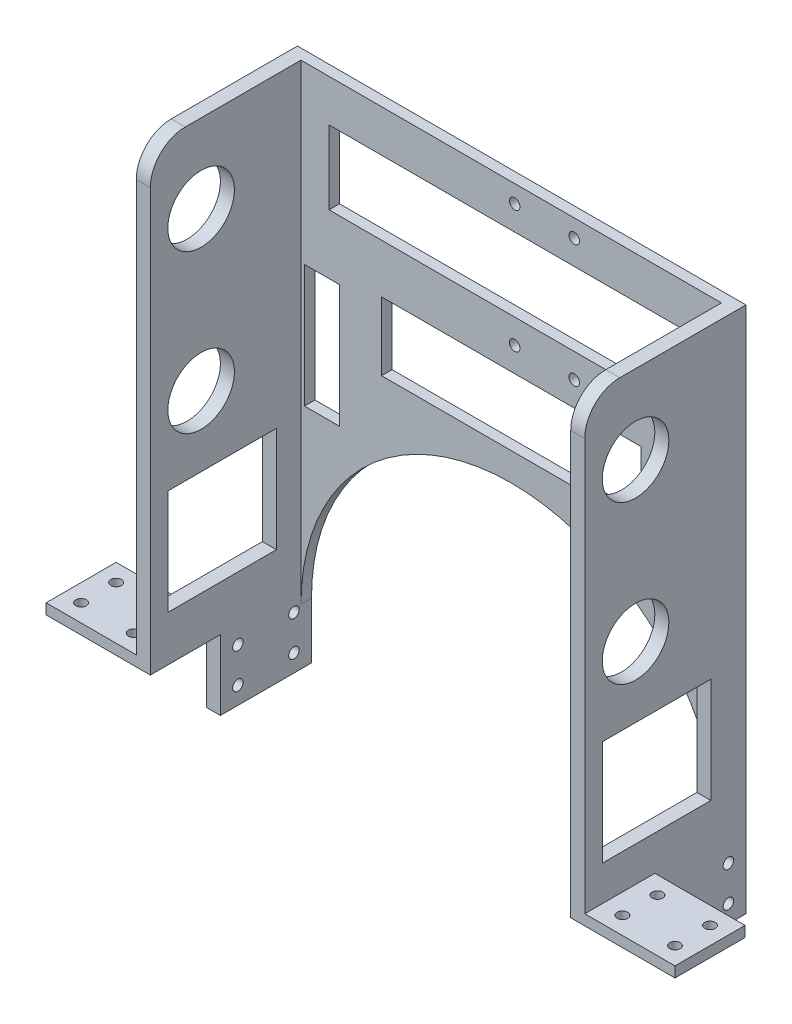
from build123d import *

# Parameters (mm, degrees)
SKETCH_1_W           = 160
SKETCH_1_H           = 157.5
EXTRUDE_1_DEPTH      = 46
SKETCH_2_W           = 120
SKETCH_2_H           = 157.5
CUT_EXTRUDE_1_DEPTH  = 43
SKETCH_3_W           = 16
SKETCH_3_H           = 155
CUT_EXTRUDE_2_DEPTH  = 122.31596144
SKETCH_4_R           = 9.5
CUT_EXTRUDE_3_DEPTH  = 171.451056025
SKETCH_5_R           = 9.5
CUT_EXTRUDE_4_DEPTH  = 171.451056025
SKETCH_7_R           = 1.5
CUT_EXTRUDE_6_DEPTH  = 10
SKETCH_10_W          = 16
SKETCH_10_H          = 26
CUT_EXTRUDE_9_DEPTH  = 10
SKETCH_11_W          = 4
SKETCH_11_H          = 26
EXTRUDE_2_DEPTH      = 20
SKETCH_13_R          = 1.5
CUT_EXTRUDE_11_DEPTH = 181.564566014
SKETCH_17_W          = 29.75
SKETCH_17_H          = 3
EXTRUDE_3_DEPTH      = 20
SKETCH_18_R          = 1.5
CUT_EXTRUDE_14_DEPTH = 20
SKETCH_19_W          = 46
SKETCH_19_H          = 27
CUT_EXTRUDE_15_DEPTH = 189.432016919
SKETCH_20_R          = 30
CUT_EXTRUDE_16_DEPTH = 10
SKETCH_21_W          = 120
SKETCH_21_H          = 56.000000256
CUT_EXTRUDE_17_DEPTH = 10
FILLET_1_R           = 60
SKETCH_22_W          = 10
SKETCH_22_H          = 35
CUT_EXTRUDE_18_DEPTH = 10
FILLET_2_R           = 10
SKETCH_24_W          = 31
SKETCH_24_H          = 30
CUT_EXTRUDE_19_DEPTH = 189.432016919
SKETCH_25_W          = 104
SKETCH_25_H          = 21
SKETCH_25_W_2        = 74
SKETCH_25_H_2        = 19.499999744
CUT_EXTRUDE_20_DEPTH = 10


with BuildPart() as part:
    # 草图1 → 凸台-拉伸1 (new body)
    with BuildSketch(Plane.XY):
        Rectangle(SKETCH_1_W, SKETCH_1_H)
    extrude(amount=EXTRUDE_1_DEPTH)

    # 草图2 → 切除-拉伸1 (cut)
    with BuildSketch(Plane.XY.offset(46)):
        Rectangle(SKETCH_2_W, SKETCH_2_H)
    extrude(amount=-CUT_EXTRUDE_1_DEPTH, mode=Mode.SUBTRACT)

    # 草图3 → 切除-拉伸2 (cut, through all)
    with BuildSketch(Plane.XY.offset(46)):
        with Locations((-72, 1.25)):
            Rectangle(SKETCH_3_W, SKETCH_3_H)
        with Locations((72, 1.25)):
            Rectangle(SKETCH_3_W, SKETCH_3_H)
    extrude(amount=-CUT_EXTRUDE_2_DEPTH, mode=Mode.SUBTRACT)

    # 草图4 → 切除-拉伸3 (cut, through all)
    with BuildSketch(Plane.ZY.offset(64)):
        with Locations((31.5, -15.75)):
            Circle(SKETCH_4_R)
    extrude(amount=-CUT_EXTRUDE_3_DEPTH, mode=Mode.SUBTRACT)

    # 草图5 → 切除-拉伸4 (cut, through all)
    with BuildSketch(Plane(origin=(64, 0, 0), x_dir=(0, 0, -1), z_dir=(1, 0, 0))):
        with Locations(Location((-31.5, 29.25, 0), (0, 0, 90))):
            Circle(SKETCH_5_R)
    extrude(amount=-CUT_EXTRUDE_4_DEPTH, mode=Mode.SUBTRACT)

    # 草图7 → 切除-拉伸6 (cut)
    with BuildSketch(Plane.XY.offset(3)):
        with Locations((1, 46.75)):
            Circle(SKETCH_7_R)
        with Locations((18, 46.75)):
            Circle(SKETCH_7_R)
        with Locations((1, 11.75)):
            Circle(SKETCH_7_R)
        with Locations((18, 11.75)):
            Circle(SKETCH_7_R)
    extrude(amount=-CUT_EXTRUDE_6_DEPTH, mode=Mode.SUBTRACT)

    # 草图10 → 切除-拉伸9 (cut)
    with BuildSketch(Plane(origin=(0, -76.25, 0), x_dir=(1, 0, 0), z_dir=(0, 1, 0))):
        with Locations((-72, -13)):
            Rectangle(SKETCH_10_W, SKETCH_10_H)
        with Locations((72, -13)):
            Rectangle(SKETCH_10_W, SKETCH_10_H)
    extrude(amount=-CUT_EXTRUDE_9_DEPTH, mode=Mode.SUBTRACT)

    # 草图11 → 凸台-拉伸2 (add)
    with BuildSketch(Plane.XZ.offset(78.75)):
        with Locations((-62, 13)):
            Rectangle(SKETCH_11_W, SKETCH_11_H)
        with Locations((62, 13)):
            Rectangle(SKETCH_11_W, SKETCH_11_H)
    extrude(amount=EXTRUDE_2_DEPTH)

    # 草图13 → 切除-拉伸11 (cut, through all)
    with BuildSketch(Plane.ZY.offset(64)):
        with Locations(Location((5, -83.75, 0), (0, 0, 270))):
            Circle(SKETCH_13_R)
        with Locations(Location((21, -83.75, 0), (0, 0, 270))):
            Circle(SKETCH_13_R)
        with Locations(Location((21, -93.75, 0), (0, 0, 270))):
            Circle(SKETCH_13_R)
        with Locations(Location((5, -93.75, 0), (0, 0, 270))):
            Circle(SKETCH_13_R)
    extrude(amount=-CUT_EXTRUDE_11_DEPTH, mode=Mode.SUBTRACT)

    # 草图17 → 凸台-拉伸3 (add)
    with BuildSketch(Plane.XY.offset(46)):
        with Locations((-74.875, -77.25)):
            Rectangle(SKETCH_17_W, SKETCH_17_H)
        with Locations((74.875, -77.25)):
            Rectangle(SKETCH_17_W, SKETCH_17_H)
    extrude(amount=-EXTRUDE_3_DEPTH)

    # 草图18 → 切除-拉伸14 (cut)
    with BuildSketch(Plane(origin=(0, -75.75, 0), x_dir=(1, 0, 0), z_dir=(0, 1, 0))):
        with Locations(Location((84.75, -31, 0), (0, 0, 270))):
            Circle(SKETCH_18_R)
        with Locations(Location((84.75, -41, 0), (0, 0, 270))):
            Circle(SKETCH_18_R)
        with Locations(Location((69.75, -31, 0), (0, 0, 270))):
            Circle(SKETCH_18_R)
        with Locations(Location((69.75, -41, 0), (0, 0, 270))):
            Circle(SKETCH_18_R)
        with Locations(Location((-69.75, -31, 0), (0, 0, 270))):
            Circle(SKETCH_18_R)
        with Locations(Location((-69.75, -41, 0), (0, 0, 270))):
            Circle(SKETCH_18_R)
        with Locations(Location((-84.75, -41, 0), (0, 0, 270))):
            Circle(SKETCH_18_R)
        with Locations(Location((-84.75, -31, 0), (0, 0, 270))):
            Circle(SKETCH_18_R)
    extrude(amount=-CUT_EXTRUDE_14_DEPTH, mode=Mode.SUBTRACT)

    # 草图19 → 切除-拉伸15 (cut, through all)
    with BuildSketch(Plane.ZY.offset(64)):
        with Locations((23, 65.25)):
            Rectangle(SKETCH_19_W, SKETCH_19_H)
    extrude(amount=-CUT_EXTRUDE_15_DEPTH, mode=Mode.SUBTRACT)

    # 草图20 → 切除-拉伸16 (cut)
    with BuildSketch(Plane.XY.offset(3)):
        with Locations((5.442e-06, -52.749999744)):
            Circle(SKETCH_20_R)
    extrude(amount=-CUT_EXTRUDE_16_DEPTH, mode=Mode.SUBTRACT)

    # 草图21 → 切除-拉伸17 (cut)
    with BuildSketch(Plane(origin=(0, 0, 0), x_dir=(-1, 0, 0), z_dir=(0, 0, -1))):
        with Locations((0, -50.749999872)):
            Rectangle(SKETCH_21_W, SKETCH_21_H)
    extrude(amount=-CUT_EXTRUDE_17_DEPTH, mode=Mode.SUBTRACT)

    # 圆角1
    fillet_1_edges = [part.edges().sort_by_distance(p)[0] for p in [
        (60, -22.749999744, 1.5),
        (-60, -22.749999744, 1.5),
    ]]
    fillet(fillet_1_edges, radius=FILLET_1_R - 0.0001)  # a hair under: the kernel refuses the full size

    # 草图22 → 切除-拉伸18 (cut)
    with BuildSketch(Plane.XY.offset(3)):
        with Locations((54, -15.75)):
            Rectangle(SKETCH_22_W, SKETCH_22_H)
        with Locations((-54, -15.75)):
            Rectangle(SKETCH_22_W, SKETCH_22_H)
    extrude(amount=-CUT_EXTRUDE_18_DEPTH, mode=Mode.SUBTRACT)

    # 圆角2
    fillet_2_edges = [part.edges().sort_by_distance(p)[0] for p in [
        (62, 51.75, 46),
        (-62, 51.75, 46),
    ]]
    fillet(fillet_2_edges, radius=FILLET_2_R)

    # 草图24 → 切除-拉伸19 (cut, through all)
    with BuildSketch(Plane.ZY.offset(64)):
        with Locations((25.5, -50.75)):
            Rectangle(SKETCH_24_W, SKETCH_24_H)
    extrude(amount=-CUT_EXTRUDE_19_DEPTH, mode=Mode.SUBTRACT)

    # 草图25 → 切除-拉伸20 (cut)
    with BuildSketch(Plane.XY.offset(3)):
        with Locations((0, 29.25)):
            Rectangle(SKETCH_25_W, SKETCH_25_H)
        with Locations((0, -4.999999872)):
            Rectangle(SKETCH_25_W_2, SKETCH_25_H_2)
    extrude(amount=-CUT_EXTRUDE_20_DEPTH, mode=Mode.SUBTRACT)


solid = part.part
